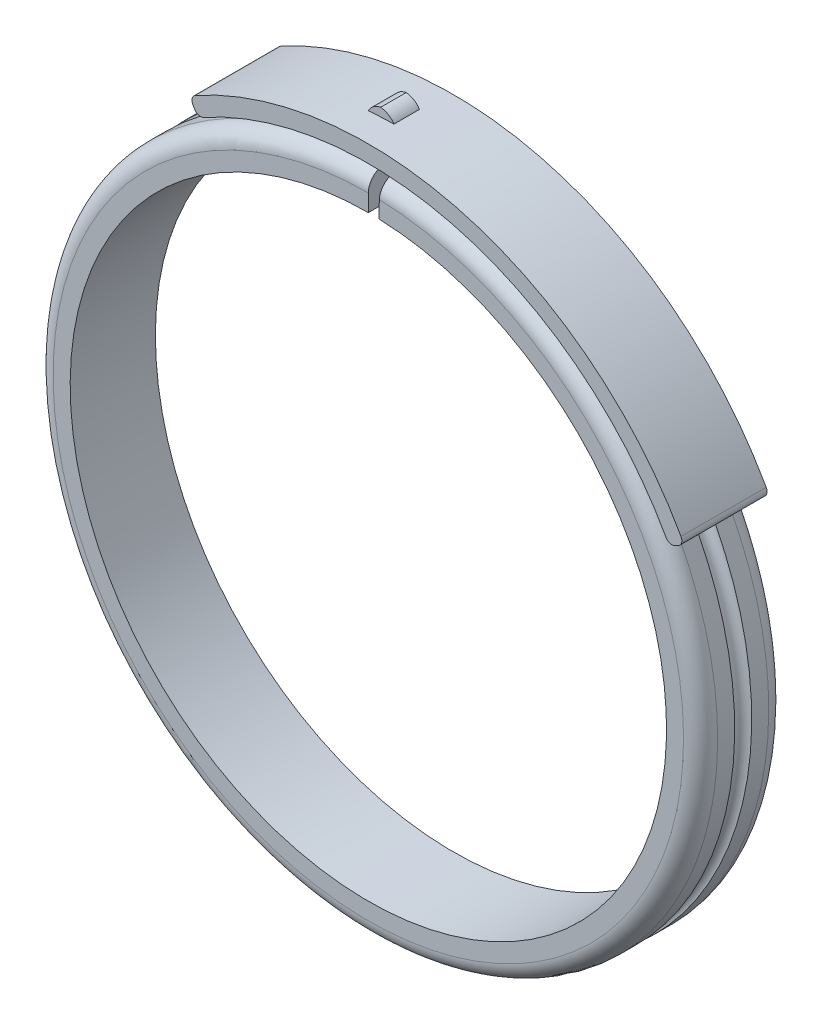
from build123d import *

# Parameters (mm, degrees)
BOSS_EXTRUDE1_DEPTH   = 10
BOSS_EXTRUDE1_2_DEPTH = 10
BOSS_EXTRUDE2_START   = 3.5
BOSS_EXTRUDE2_DEPTH   = 3
FILLET1_R             = 2
SKETCH4_R             = 1
FILLET2_R             = 2


# Read off the part's stored shape, not the designer's step: Boss-Extrude2
with BuildPart() as part:
    # Sketch1 → Boss-Extrude1 (new body)
    with BuildSketch(Plane.XY):
        with BuildLine():
            ThreePointArc((35, 0), (-24.748737342, -24.748737342), (0, 35))
            Line((0, 35), (0, 39))
            ThreePointArc((0, 39), (-27.577164466, -27.577164466), (39, 0))
            ThreePointArc((39, 0), (28.054252213, 27.091676448), (1.361080371, 38.976242254))
            Line((1.361080371, 38.976242254), (1.221482385, 34.978678946))
            ThreePointArc((1.221482385, 34.978678946), (25.176893012, 24.313042966), (35, 0))
        make_face()
    extrude(amount=BOSS_EXTRUDE1_DEPTH)



with BuildPart() as body_2:
    # Sketch1 → Boss-Extrude1 2 (new body)
    with BuildSketch(Plane.XY):
        with BuildLine():
            ThreePointArc((36.693937221, 20.434161867), (11.576768944, 40.372991229), (-20.289767579, 36.773976282))
            ThreePointArc((-20.289767579, 36.773976282), (-20.673989714, 36.288067757), (-20.596116139, 35.673519591))
            Line((-20.596116139, 35.673519591), (-20.396078054, 35.327043465))
            ThreePointArc((-20.396078054, 35.327043465), (-19.917879268, 34.956369996), (-19.316919344, 35.026513201))
            ThreePointArc((-19.316919344, 35.026513201), (11.025494233, 38.450467838), (34.942900778, 19.467760149))
            ThreePointArc((34.942900778, 19.467760149), (35.415373462, 19.089815097), (36.017336044, 19.150757278))
            Line((36.017336044, 19.150757278), (36.370582334, 19.338581662))
            ThreePointArc((36.370582334, 19.338581662), (36.762283783, 19.818481357), (36.693937221, 20.434161867))
        make_face()
    extrude(amount=BOSS_EXTRUDE1_2_DEPTH)


with BuildPart() as part_1:
    add(part.part)

    add(body_2.part)  # Boss-Extrude2 merges body 2
    # Boss-Extrude2 outline → Boss-Extrude2 (add)
    with BuildSketch(Plane.XY.offset(BOSS_EXTRUDE2_START)):
        with BuildLine():
            ThreePointArc((-3.5, 38.842631218), (-2.001484848, 38.948607913), (-0.5, 38.99679474))
            Line((-0.5, 38.99679474), (-0.5, 39.996874878))
            ThreePointArc((-0.5, 39.996874878), (-2.001411272, 39.949898034), (-3.5, 39.846580782))
            Line((-3.5, 39.846580782), (-3.5, 38.842631218))
        make_face()
        with BuildLine():
            ThreePointArc((-3.5, 41.853912601), (-2.00127964, 41.952292902), (-0.5, 41.997023704))
            Line((-0.5, 41.997023704), (-0.5, 42.99679474))
            ThreePointArc((-0.5, 42.99679474), (-2.001484848, 42.948607914), (-3.5, 42.842631219))
            Line((-3.5, 42.842631219), (-3.5, 41.853912601))
        make_face()
    extrude(amount=BOSS_EXTRUDE2_DEPTH)

    # Fillet1
    # the kernel refuses this fillet: 2 mm, written as the material it takes off along each edge
    with BuildSketch(Plane(origin=(-0.5, 42.99679474, -1.036121559), x_dir=(0, -1, 0), z_dir=(0, 0, 1))) as fillet1_piece_1:
        with BuildLine():
            CenterArc((2.061939079, -1.694638323), FILLET1_R, 122.078727106, 61.321742155)
            Line((0.065460395, -1.813267422), (0.025530821, -1.815640004))
            ThreePointArc((0.025530821, -1.815640004), (-0.01779032, -0.908457542), (-0.039996713, -0.00051282))
            Line((-0.039996713, -0.00051282), (0, 0.04))
            ThreePointArc((0, 0.04), (0.499885518, 0.04), (0.978527675, 0.033892766))
            Line((0.978527675, 0.033892766), (0.999771036, 0))
        make_face()
    extrude(amount=12.072243117, mode=Mode.SUBTRACT)
    with BuildSketch(Plane(origin=(-3.5, 42.842631219, -0.751991115), x_dir=(0, -1, 0), z_dir=(0, 0, 1))) as fillet1_piece_2:
        with BuildLine():
            CenterArc((1.882198311, 1.789327817), FILLET1_R, 182.649979703, 60.815312802)
            Line((-0.115662927, 1.696859051), (-0.155620152, 1.695009676))
            ThreePointArc((-0.155620152, 1.695009676), (-0.10699, 0.845078734), (-0.039838596, -0.003589744))
            Line((-0.039838596, -0.003589744), (0, -0.04))
            ThreePointArc((0, -0.04), (0.494359309, -0.04), (0.970849024, -0.035786556))
            Line((0.970849024, -0.035786556), (0.988718618, 0))
        make_face()
    extrude(amount=11.503982231, mode=Mode.SUBTRACT)

    # Sketch4 → Cut-Revolve1 (revolve, cut)
    with BuildSketch(Plane(origin=(0, 0, 0), x_dir=(0, 0, -1), z_dir=(1, 0, 0)), mode=Mode.PRIVATE) as cut_revolve1_sk:
        with Locations((-5, 38.99679474)):
            Circle(SKETCH4_R)
    revolve(cut_revolve1_sk.sketch.rotate(Axis((0, 0, 0), (0, 0, 1)), 2.941718787), axis=Axis((0, 0, 0), (0, 0, 1)), mode=Mode.SUBTRACT)

    # Fillet2
    fillet2_edges = [part_1.edges().sort_by_distance(p)[0] for p in [
        (-27.577164466, -27.577164466, 10),
        (-27.577164466, -27.577164466, 0),
    ]]
    fillet(fillet2_edges, radius=FILLET2_R)


solid = part_1.part
